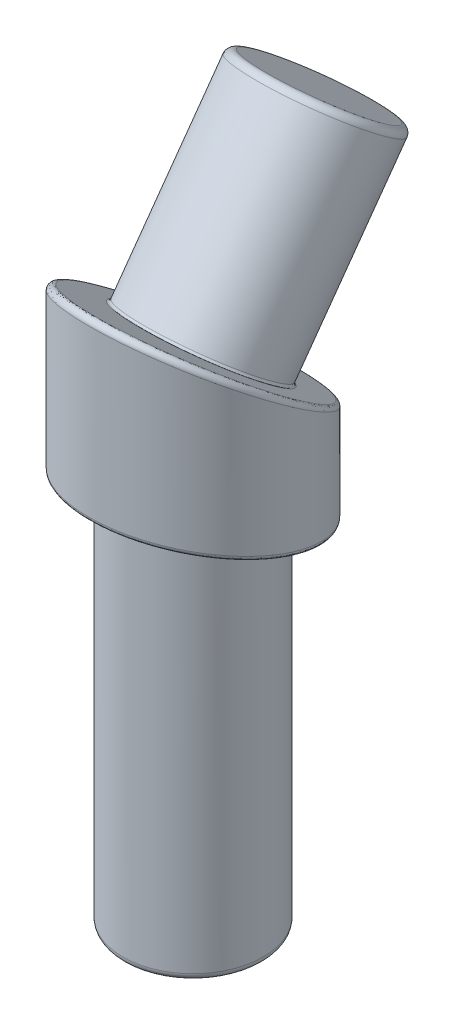
from build123d import *

# Parameters (mm, degrees)
SKETCH1_R           = 2.925
BOSS_EXTRUDE1_DEPTH = 16.35
SKETCH5_RX          = 5.356877772
SKETCH5_RY          = 4.325
SKETCH4_RX          = 4.540466383
SKETCH4_RY          = 4.325
SKETCH6_R           = 2.985
BOSS_EXTRUDE2_DEPTH = 8.43
FILLET1_R           = 0.3
FILLET2_R           = 0.2
FILLET3_R           = 0.1


with BuildPart() as part:
    # Sketch1 → Boss-Extrude1 (new body)
    with BuildSketch(Plane(origin=(0, 0, 0), x_dir=(1, 0, 0), z_dir=(0, 1, 0))):
        with Locations(Location((0, 0, 0), (0, 0, 270))):
            Circle(SKETCH1_R)
    extrude(amount=BOSS_EXTRUDE1_DEPTH)

    # Sketch5 → Loft1 section 0
    with BuildSketch(Plane(origin=(0, 13.913535321, -9.999456493), x_dir=(0, -0.5836015276700488, -0.8120401818267279), z_dir=(0, -0.8120401818267279, 0.5836015276700488))):
        with Locations(Location((-12.313992234, 0), (0, 0, 0))):
            Ellipse(SKETCH5_RX, SKETCH5_RY)
    # Sketch4 → Loft1 section 1
    with BuildSketch(Plane(origin=(0, 14.203920813, -4.249036141), x_dir=(0, 0.2865965611145711, 0.958051361440138), z_dir=(0, 0.958051361440138, -0.2865965611145711))):
        with Locations(Location((4.435081783, 0), (0, 0, 180))):
            Ellipse(SKETCH4_RX, SKETCH4_RY)
    loft()

    # Sketch6 → Boss-Extrude2 (add)
    with BuildSketch(Plane(origin=(0, 13.913535321, -9.999456493), x_dir=(1, 0, 0), z_dir=(0, 0.8120401818267279, -0.5836015276700489))):
        with Locations(Location((0, -11.885870006, 0), (0, 0, 90))):
            Circle(SKETCH6_R)
    extrude(amount=BOSS_EXTRUDE2_DEPTH)

    # Fillet1
    fillet1_edges = [part.edges().sort_by_distance(p)[0] for p in [
        (0, 29.437696507, -2.843473387),
        (0, 0, -2.925),
    ]]
    fillet(fillet1_edges, radius=FILLET1_R)

    # Fillet2
    fillet2_edges = [part.edges().sort_by_distance(p)[0] for p in [
        (-0.00059328, 24.226282022, 4.349999959),
        (7.357e-06, 16.776282051, 4.35),
    ]]
    fillet(fillet2_edges, radius=FILLET2_R)

    # Fillet3
    fillet3_edges = [part.edges().sort_by_distance(p)[0] for p in [
        (0, 22.592197774, 2.076287491),
        (-3.504e-06, 14.6, -2.925),
    ]]
    fillet(fillet3_edges, radius=FILLET3_R)


solid = part.part
